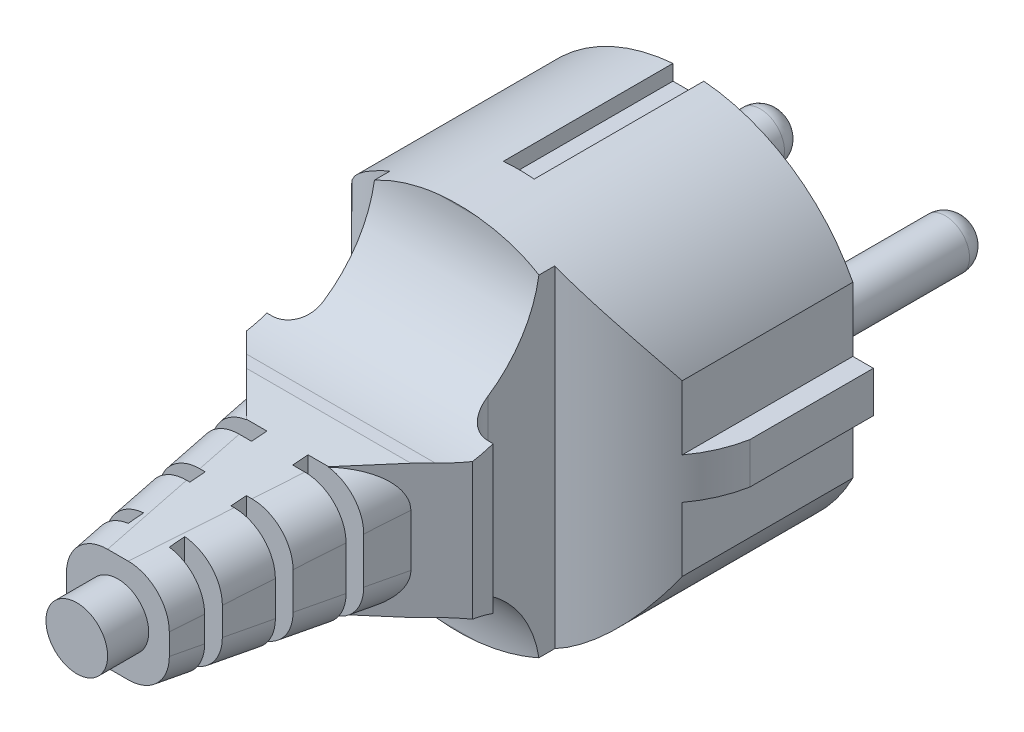
from build123d import *

# Parameters (mm, degrees)
BOSS_EXTRUDE1_DEPTH  = 55.5
SKETCH4_OUTSIDE_W    = 53.062
SKETCH4_OUTSIDE_H    = 72.562
CUT_EXTRUDE3_DEPTH   = 20
CUT_EXTRUDE4_DEPTH   = 16.5
SKETCH6_R            = 5
BOSS_EXTRUDE3_DEPTH  = 55.5
SKETCH7_OUTSIDE_W    = 72.562
SKETCH7_OUTSIDE_H    = 53.062
CUT_EXTRUDE6_DEPTH   = 27.75
FILLET3_R            = 4
SKETCH8_R            = 2.35
BOSS_EXTRUDE4_DEPTH  = 18
FILLET4_R            = 2
FILLET4_OF_MIRROR2_R = 2
SKETCH10_W           = 8.464758564
SKETCH10_H           = 1.5
CUT_EXTRUDE8_DEPTH   = 12
SKETCH11_R           = 3
BOSS_EXTRUDE6_DEPTH  = 59.5
SKETCH12_R           = 2.35
CUT_EXTRUDE9_DEPTH   = 10


with BuildPart() as part:
    # Sketch1 → Boss-Extrude1 (new body)
    with BuildSketch(Plane.XY):
        with BuildLine():
            Line((-16, 2), (-16, 8.246211251))
            ThreePointArc((-16, 8.246211251), (0, 18), (16, 8.246211251))
            Line((16, 8.246211251), (16, 2))
            Line((16, 2), (18, 2))
            Line((18, 2), (18, -2))
            Line((18, -2), (16, -2))
            Line((16, -2), (16, -8.246211251))
            ThreePointArc((16, -8.246211251), (0, -18), (-16, -8.246211251))
            Line((-16, -8.246211251), (-16, -2))
            Line((-16, -2), (-18, -2))
            Line((-18, -2), (-18, 2))
            Line((-18, 2), (-16, 2))
        make_face()
    extrude(amount=BOSS_EXTRUDE1_DEPTH)

    # Sketch4 outside → Cut-Extrude3 (cut, symmetric)
    with BuildSketch(Plane(origin=(0, 0, 0), x_dir=(1, 0, 0), z_dir=(0, 1, 0))):
        with Locations((0, -27.75)):
            Rectangle(SKETCH4_OUTSIDE_W, SKETCH4_OUTSIDE_H)
        with BuildLine():
            Line((-18, 0), (-18, -12))
            ThreePointArc((-18, -12), (-14.536312565, -18.207013961), (-8, -21))
            Line((-8, -21), (-8, -27.5))
            ThreePointArc((-8, -27.5), (-8.732233047, -29.267766953), (-10.5, -30))
            Line((-10.5, -30), (-11, -30))
            Line((-11, -30), (-11, -32))
            Line((-11, -32), (-8, -35))
            Line((-8, -35), (-5, -55.5))
            Line((-5, -55.5), (5, -55.5))
            Line((5, -55.5), (8, -35))
            Line((8, -35), (11, -32))
            Line((11, -32), (11, -30))
            Line((11, -30), (10.5, -30))
            ThreePointArc((10.5, -30), (8.732233047, -29.267766953), (8, -27.5))
            Line((8, -27.5), (8, -21))
            ThreePointArc((8, -21), (14.536312565, -18.207013961), (18, -12))
            Line((18, -12), (18, 0))
            Line((18, 0), (-18, 0))
        make_face(mode=Mode.SUBTRACT)
    extrude(amount=CUT_EXTRUDE3_DEPTH, both=True, mode=Mode.SUBTRACT)

    # Sketch5 → Cut-Extrude4 (cut)
    with BuildSketch(Plane(origin=(0, 0, 0), x_dir=(-1, 0, 0), z_dir=(0, 0, -1))):
        Polygon((0, 19.680001022), (1.5, 19.680001022), (1.5, 17.937391115), (1.5, 16.437391115), (-1.5, 16.437391115), (-1.5, 19.680001022), align=None)
    cut_extrude4 = extrude(amount=-CUT_EXTRUDE4_DEPTH, mode=Mode.SUBTRACT)

    # Mirror1: Cut-Extrude4 across plane
    add(cut_extrude4.mirror(Plane.ZX), mode=Mode.SUBTRACT)

    # Sketch6 → Boss-Extrude3 (add)
    with BuildSketch(Plane.XY):
        Circle(SKETCH6_R)
    extrude(amount=BOSS_EXTRUDE3_DEPTH)

    # Sketch7 outside → Cut-Extrude6 (cut, symmetric)
    with BuildSketch(Plane(origin=(0, 0, 0), x_dir=(0, 0, -1), z_dir=(1, 0, 0))):
        with Locations((-27.75, 0)):
            Rectangle(SKETCH7_OUTSIDE_W, SKETCH7_OUTSIDE_H)
        with BuildLine():
            Line((-22.4, 17.937391115), (-22.4, 20.910001086))
            Line((-22.4, 20.910001086), (0, 20.910001086))
            Line((0, 20.910001086), (0, 17.937391115))
            Line((0, 17.937391115), (0, -17.937391115))
            Line((0, -17.937391115), (0, -20.333967998))
            Line((0, -20.333967998), (-22.4, -20.333967998))
            Line((-22.4, -20.333967998), (-22.4, -17.9))
            ThreePointArc((-22.4, -17.9), (-25.738982694, -9.838982694), (-33.8, -6.5))
            Line((-33.8, -6.5), (-35, -6.5))
            Line((-35, -6.5), (-55.5, -5))
            Line((-55.5, -5), (-55.5, 5))
            Line((-55.5, 5), (-35, 6.5))
            Line((-35, 6.5), (-33.8, 6.5))
            ThreePointArc((-33.8, 6.5), (-25.738982694, 9.838982694), (-22.4, 17.9))
            Line((-22.4, 17.9), (-22.4, 17.937391115))
        make_face(mode=Mode.SUBTRACT)
    extrude(amount=CUT_EXTRUDE6_DEPTH, both=True, mode=Mode.SUBTRACT)

    # Fillet3
    # the kernel refuses this fillet: 4 mm, written as the material it takes off along each edge
    with BuildSketch(Plane(origin=(3.570969245, 4.285484623, 65.26504349), x_dir=(0.010456033399530511, -0.9973894081641158, -0.0714495615632633), z_dir=(0.14442116856011564, 0.07221058427983153, -0.9868779851580924))) as fillet3_piece_1_section:
        with BuildLine():
            CenterArc((FILLET3_R * 0.989488430862, FILLET3_R), FILLET3_R, 180.605445032, 89.394554968)
            Line((-FILLET3_R * 0.0104557388149, FILLET3_R * 0.989433187404), (0, 0))
            Line((0, 0), (FILLET3_R * 0.989488430862, 0))
        make_face()
    fillet3_piece_1 = extrude(amount=40.562346695, mode=Mode.PRIVATE)
    fillet3_piece_1 = split(fillet3_piece_1, bisect_by=Plane(origin=(-1.347793771, 4.447005001, 44.347793771), z_dir=(0.7071067811865519, 0, 0.7071067811865431)), keep=Keep.TOP, mode=Mode.PRIVATE)
    add(fillet3_piece_1, mode=Mode.SUBTRACT)
    with BuildSketch(Plane(origin=(9.429030755, -7.214515377, 25.23495651), x_dir=(0.01045603339953013, 0.9973894081641159, -0.07144956156326311), z_dir=(-0.14442116856011564, 0.07221058427983126, 0.9868779851580924))) as fillet3_piece_2_section:
        with BuildLine():
            CenterArc((FILLET3_R * 0.989488430862, FILLET3_R), FILLET3_R, 180.605445032, 89.394554968)
            Line((-FILLET3_R * 0.0104557388149, FILLET3_R * 0.989433187404), (0, 0))
            Line((0, 0), (FILLET3_R * 0.989488430862, 0))
        make_face()
    fillet3_piece_2 = extrude(amount=40.562346695, mode=Mode.PRIVATE)
    fillet3_piece_2 = split(fillet3_piece_2, bisect_by=Plane(origin=(-1.347793771, -4.447005001, 44.347793771), z_dir=(0.7071067811865519, 0, 0.7071067811865431)), keep=Keep.TOP, mode=Mode.PRIVATE)
    add(fillet3_piece_2, mode=Mode.SUBTRACT)
    with BuildSketch(Plane(origin=(-9.429030755, 7.214515377, 25.23495651), x_dir=(-0.010456033399530862, -0.9973894081641158, -0.07144956156326325), z_dir=(0.14442116856011541, -0.07221058427983153, 0.9868779851580924))) as fillet3_piece_3_section:
        with BuildLine():
            CenterArc((FILLET3_R * 0.989488430862, FILLET3_R), FILLET3_R, 180.605445032, 89.394554968)
            Line((-FILLET3_R * 0.0104557388149, FILLET3_R * 0.989433187404), (0, 0))
            Line((0, 0), (FILLET3_R * 0.989488430862, 0))
        make_face()
    fillet3_piece_3 = extrude(amount=40.562346695, mode=Mode.PRIVATE)
    fillet3_piece_3 = split(fillet3_piece_3, bisect_by=Plane(origin=(1.347793771, 4.447005001, 44.347793771), z_dir=(-0.7071067811865516, 0, 0.7071067811865436)), keep=Keep.TOP, mode=Mode.PRIVATE)
    add(fillet3_piece_3, mode=Mode.SUBTRACT)
    with BuildSketch(Plane(origin=(-3.570969245, -4.285484623, 65.26504349), x_dir=(0.9895163091489351, -0.010539226961374241, -0.1440361018055054), z_dir=(-0.14442116856011541, -0.07221058427983126, -0.9868779851580924))) as fillet3_piece_4_section:
        with BuildLine():
            CenterArc((FILLET3_R * 0.989488430862, -FILLET3_R), FILLET3_R, 90, 89.394554968)
            Line((-FILLET3_R * 0.0104557388149, -FILLET3_R * 0.989433187404), (0, 0))
            Line((0, 0), (FILLET3_R * 0.989488430862, 0))
        make_face()
    fillet3_piece_4 = extrude(amount=40.562346695, mode=Mode.PRIVATE)
    fillet3_piece_4 = split(fillet3_piece_4, bisect_by=Plane(origin=(1.347793771, -4.447005001, 44.347793771), z_dir=(-0.7071067811865516, 0, 0.7071067811865436)), keep=Keep.TOP, mode=Mode.PRIVATE)
    add(fillet3_piece_4, mode=Mode.SUBTRACT)

    # Sketch8 → Boss-Extrude4 (add)
    with BuildSketch(Plane(origin=(0, 0, 0), x_dir=(-1, 0, 0), z_dir=(0, 0, -1))):
        with Locations(Location((-9, 0, 0), (0, 0, 180))):
            Circle(SKETCH8_R)
    boss_extrude4 = extrude(amount=BOSS_EXTRUDE4_DEPTH)

    # Fillet4
    fillet4_edges = [part.edges().sort_by_distance(p)[0] for p in [
        (6.65, 0, -18),
    ]]
    fillet(fillet4_edges, radius=FILLET4_R)

    # Mirror2: Boss-Extrude4 across plane
    add(boss_extrude4.mirror(Plane(origin=(0, 0, 0), x_dir=(0, 0, 1), z_dir=(1, 0, 0))))

    # Fillet4 of Mirror2
    fillet4_of_mirror2_edges = [part.edges().sort_by_distance(p)[0] for p in [
        (-6.65, 0, -18),
    ]]
    fillet(fillet4_of_mirror2_edges, radius=FILLET4_OF_MIRROR2_R)

    # Sketch10 → Cut-Extrude8 (cut, symmetric)
    with BuildSketch(Plane(origin=(0, 0, 0), x_dir=(1, 0, 0), z_dir=(0, 1, 0))):
        with Locations((6.232463803, -39.75)):
            Rectangle(SKETCH10_W, SKETCH10_H)
        with Locations((6.232463803, -45.75)):
            Rectangle(SKETCH10_W, SKETCH10_H)
        with Locations((6.232463803, -51.75)):
            Rectangle(SKETCH10_W, SKETCH10_H)
        with Locations((-6.232463803, -51.75)):
            Rectangle(SKETCH10_W, SKETCH10_H)
        with Locations((-6.232463803, -45.75)):
            Rectangle(SKETCH10_W, SKETCH10_H)
        with Locations((-6.232463803, -39.75)):
            Rectangle(SKETCH10_W, SKETCH10_H)
    extrude(amount=CUT_EXTRUDE8_DEPTH, both=True, mode=Mode.SUBTRACT)

    # Sketch11 → Boss-Extrude6 (add)
    with BuildSketch(Plane.XY):
        Circle(SKETCH11_R)
    extrude(amount=BOSS_EXTRUDE6_DEPTH)

    # Sketch12 → Cut-Extrude9 (cut)
    with BuildSketch(Plane(origin=(0, 0, 0), x_dir=(-1, 0, 0), z_dir=(0, 0, -1))):
        with Locations((0, -9)):
            Circle(SKETCH12_R)
    extrude(amount=-CUT_EXTRUDE9_DEPTH, mode=Mode.SUBTRACT)


solid = part.part
